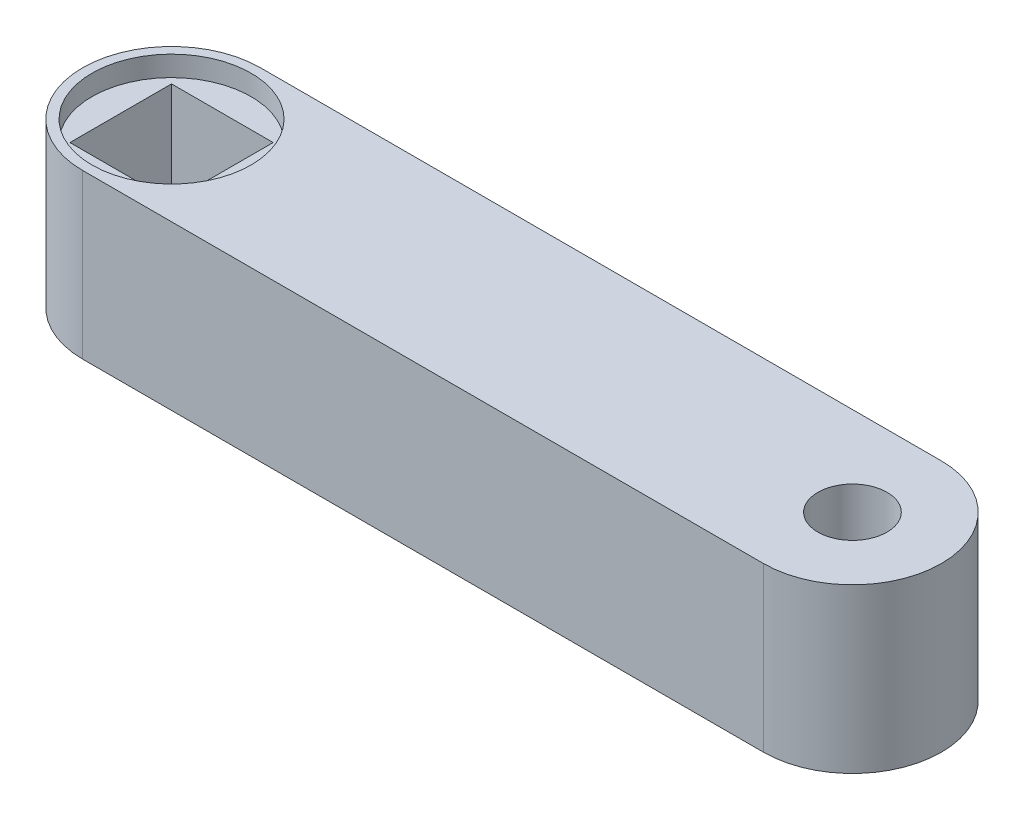
from build123d import *

# Parameters (mm, degrees)
BOSS_EXTRUDE1_DEPTH = 10.2108
SKETCH2_R           = 2.159
SKETCH2_W           = 6.35
SKETCH2_H           = 6.35
CUT_EXTRUDE1_DEPTH  = 50.485983897
SKETCH3_R           = 4.97205
CUT_EXTRUDE2_DEPTH  = 1.27


with BuildPart() as part:
    # Sketch1 → Boss-Extrude1 (new body)
    with BuildSketch(Plane(origin=(0, 0, 0), x_dir=(1, 0, 0), z_dir=(0, 1, 0))):
        with BuildLine():
            Line((0, 5.55625), (42.545, 5.55625))
            ThreePointArc((42.545, 5.55625), (48.10125, 0), (42.545, -5.55625))
            Line((42.545, -5.55625), (0, -5.55625))
            ThreePointArc((0, -5.55625), (-5.55625, 0), (0, 5.55625))
        make_face()
    extrude(amount=BOSS_EXTRUDE1_DEPTH)

    # Sketch2 → Cut-Extrude1 (cut, through all)
    with BuildSketch(Plane(origin=(0, 10.2108, 0), x_dir=(1, 0, 0), z_dir=(0, 1, 0))):
        with Locations((42.545, 0)):
            Circle(SKETCH2_R)
        Rectangle(SKETCH2_W, SKETCH2_H)
    extrude(amount=-CUT_EXTRUDE1_DEPTH, mode=Mode.SUBTRACT)

    # Sketch3 → Cut-Extrude2 (cut)
    with BuildSketch(Plane(origin=(0, 10.2108, 0), x_dir=(1, 0, 0), z_dir=(0, 1, 0))):
        Circle(SKETCH3_R)
    cut_extrude2 = extrude(amount=-CUT_EXTRUDE2_DEPTH, mode=Mode.SUBTRACT)

    # Mirror1: Cut-Extrude2 across plane
    add(cut_extrude2.mirror(Plane.ZX.offset(5.1054)), mode=Mode.SUBTRACT)


solid = part.part
